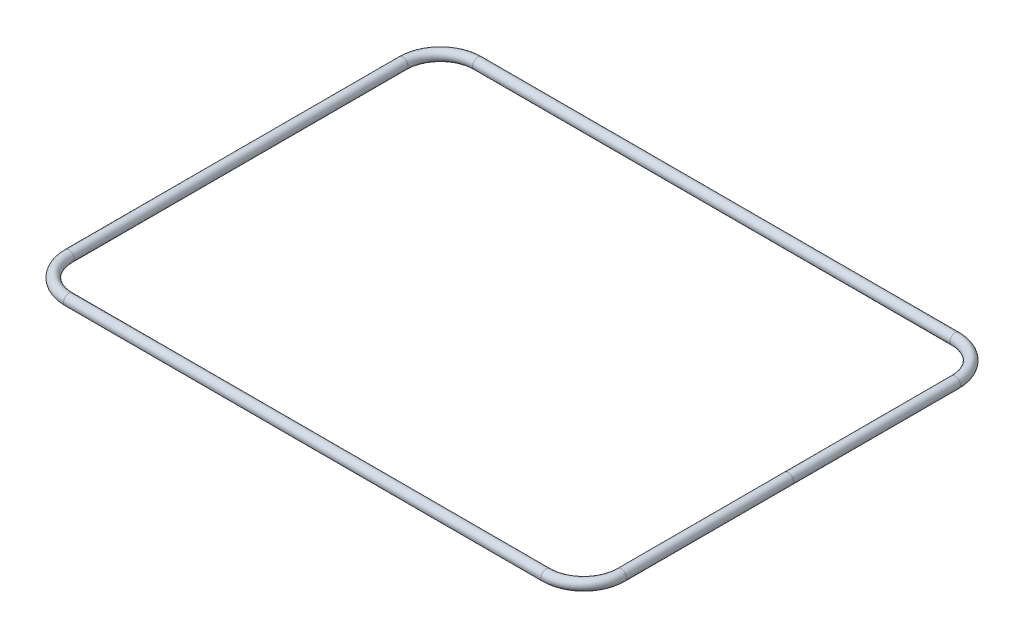
from build123d import *

# Parameters (mm, degrees)
O_RINGPROFILE_R = 1.7653


with BuildPart() as part:
    # Sweep2: sweep along a path in O-RingPath
    with BuildLine(Plane(origin=(0, 0, 0), x_dir=(1, 0, 0), z_dir=(0, 1, 0))) as sweep2_path:
        Line((80.671323394, -69.1388), (-80.671323394, -69.1388))
        ThreePointArc((-80.671323394, -69.1388), (-89.651579515, -65.419056121), (-93.371323394, -56.4388))
        Line((-93.371323394, -56.4388), (-93.371323394, 56.4388))
        ThreePointArc((-93.371323394, 56.4388), (-89.651579515, 65.419056121), (-80.671323394, 69.1388))
        Line((-80.671323394, 69.1388), (80.671323394, 69.1388))
        ThreePointArc((80.671323394, 69.1388), (89.651579515, 65.419056121), (93.371323394, 56.4388))
        Line((93.371323394, 56.4388), (93.371323394, -56.4388))
        ThreePointArc((93.371323394, -56.4388), (89.651579515, -65.419056121), (80.671323394, -69.1388))
    # O-RingProfile → Sweep2 (sweep)
    with BuildSketch(Plane.XY):
        with Locations((93.371323394, 0)):
            Circle(O_RINGPROFILE_R)
    sweep(path=sweep2_path.line)


solid = part.part
